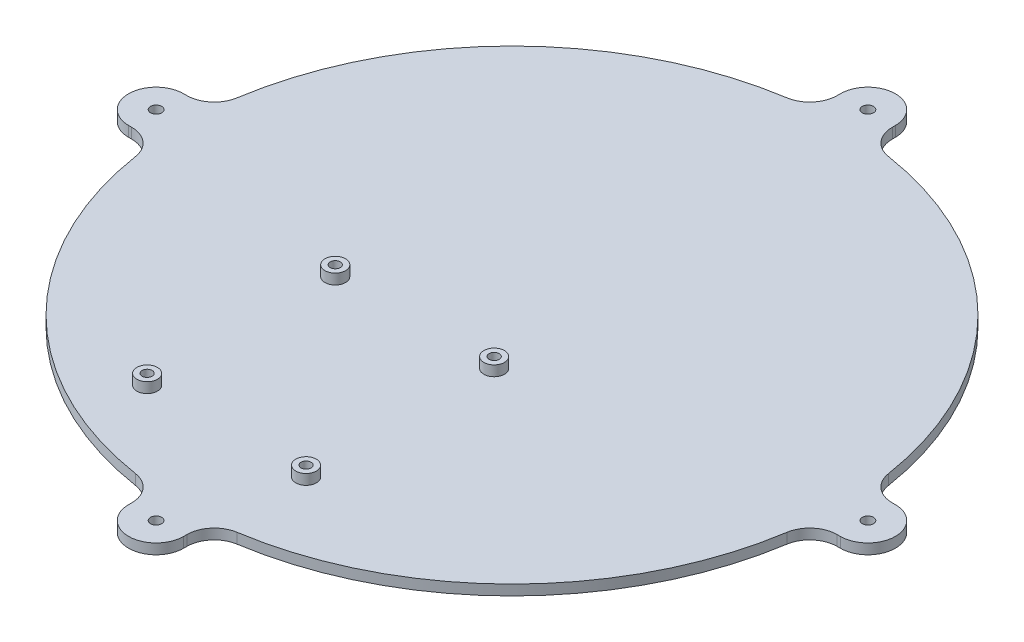
from build123d import *

# Parameters (mm, degrees)
SKETCH1_R                                            = 1.7272
BOSS_EXTRUDE1_DEPTH                                  = 3.175
FILLET2_R                                            = 8.4836
SKETCH2_R                                            = 3.175
BOSS_EXTRUDE2_DEPTH                                  = 3.175
CSK_FOR_M2_5_CROSS_COUNTERSUNK_HEAD_SCRE_D           = 3.1
CSK_FOR_M2_5_CROSS_COUNTERSUNK_HEAD_SCRE_CSINK_D     = 5
CSK_FOR_M2_5_CROSS_COUNTERSUNK_HEAD_SCRE_CSINK_ANGLE = 92


with BuildPart() as part:
    # Sketch1 → Boss-Extrude1 (new body)
    with BuildSketch(Plane(origin=(0, 0, 0), x_dir=(1, 0, 0), z_dir=(0, 1, 0))):
        with BuildLine():
            Line((-8.4836, 101.245190162), (-8.4836, 109.728790162))
            ThreePointArc((-8.4836, 109.728790162), (0, 118.212390162), (8.4836, 109.728790162))
            Line((8.4836, 109.728790162), (8.4836, 101.245190162))
            ThreePointArc((8.4836, 101.245190162), (71.842048969, 71.842048969), (101.245190162, 8.4836))
            Line((101.245190162, 8.4836), (109.728790162, 8.4836))
            ThreePointArc((109.728790162, 8.4836), (118.212390162, 0), (109.728790162, -8.4836))
            Line((109.728790162, -8.4836), (101.245190162, -8.4836))
            ThreePointArc((101.245190162, -8.4836), (71.842048969, -71.842048969), (8.4836, -101.245190162))
            Line((8.4836, -101.245190162), (8.4836, -109.728790162))
            ThreePointArc((8.4836, -109.728790162), (0, -118.212390162), (-8.4836, -109.728790162))
            Line((-8.4836, -109.728790162), (-8.4836, -101.245190162))
            ThreePointArc((-8.4836, -101.245190162), (-71.842048969, -71.842048969), (-101.245190162, -8.4836))
            Line((-101.245190162, -8.4836), (-109.728790162, -8.4836))
            ThreePointArc((-109.728790162, -8.4836), (-118.212390162, 0), (-109.728790162, 8.4836))
            Line((-109.728790162, 8.4836), (-101.245190162, 8.4836))
            ThreePointArc((-101.245190162, 8.4836), (-71.842048969, 71.842048969), (-8.4836, 101.245190162))
        make_face()
        with Locations((0, 109.728790162)):
            Circle(SKETCH1_R, mode=Mode.SUBTRACT)
        with Locations((109.728790162, 0)):
            Circle(SKETCH1_R, mode=Mode.SUBTRACT)
        with Locations((0, -109.728790162)):
            Circle(SKETCH1_R, mode=Mode.SUBTRACT)
        with Locations((-109.728790163, 0)):
            Circle(SKETCH1_R, mode=Mode.SUBTRACT)
    extrude(amount=BOSS_EXTRUDE1_DEPTH)

    # Fillet2
    fillet2_edges = [part.edges().sort_by_distance(p)[0] for p in [
        (-8.4836, 1.5875, -101.245190162),
        (8.4836, 1.5875, -101.245190162),
        (101.245190162, 1.5875, -8.4836),
        (101.245190162, 1.5875, 8.4836),
        (8.4836, 1.5875, 101.245190162),
        (-8.4836, 1.5875, 101.245190162),
        (-101.245190162, 1.5875, -8.4836),
        (-101.245190162, 1.5875, 8.4836),
    ]]
    fillet(fillet2_edges, radius=FILLET2_R)

    # Sketch2 → Boss-Extrude2 (add)
    with BuildSketch(Plane(origin=(0, 3.175, 0), x_dir=(1, 0, 0), z_dir=(0, 1, 0))):
        with Locations((-37.514063478, -74.985936522)):
            Circle(SKETCH2_R)
        with Locations((-37.514063478, -16.985936522)):
            Circle(SKETCH2_R)
        with Locations((11.485936522, -74.985936522)):
            Circle(SKETCH2_R)
        with Locations((11.485936522, -16.985936522)):
            Circle(SKETCH2_R)
    extrude(amount=BOSS_EXTRUDE2_DEPTH)

    # CSK for M2.5 Cross Countersunk Head Screw4 (through all)
    with Locations(Plane(origin=(0, 0, 0), x_dir=(-1, 0, 0), z_dir=(0, -1, 0))):
        with Locations((-11.485936522, -16.985936522), (37.514063478, -16.985936522), (37.514063478, -74.985936522), (-11.485936522, -74.985936522)):
            CounterSinkHole(CSK_FOR_M2_5_CROSS_COUNTERSUNK_HEAD_SCRE_D / 2, CSK_FOR_M2_5_CROSS_COUNTERSUNK_HEAD_SCRE_CSINK_D / 2, counter_sink_angle=CSK_FOR_M2_5_CROSS_COUNTERSUNK_HEAD_SCRE_CSINK_ANGLE)


solid = part.part
